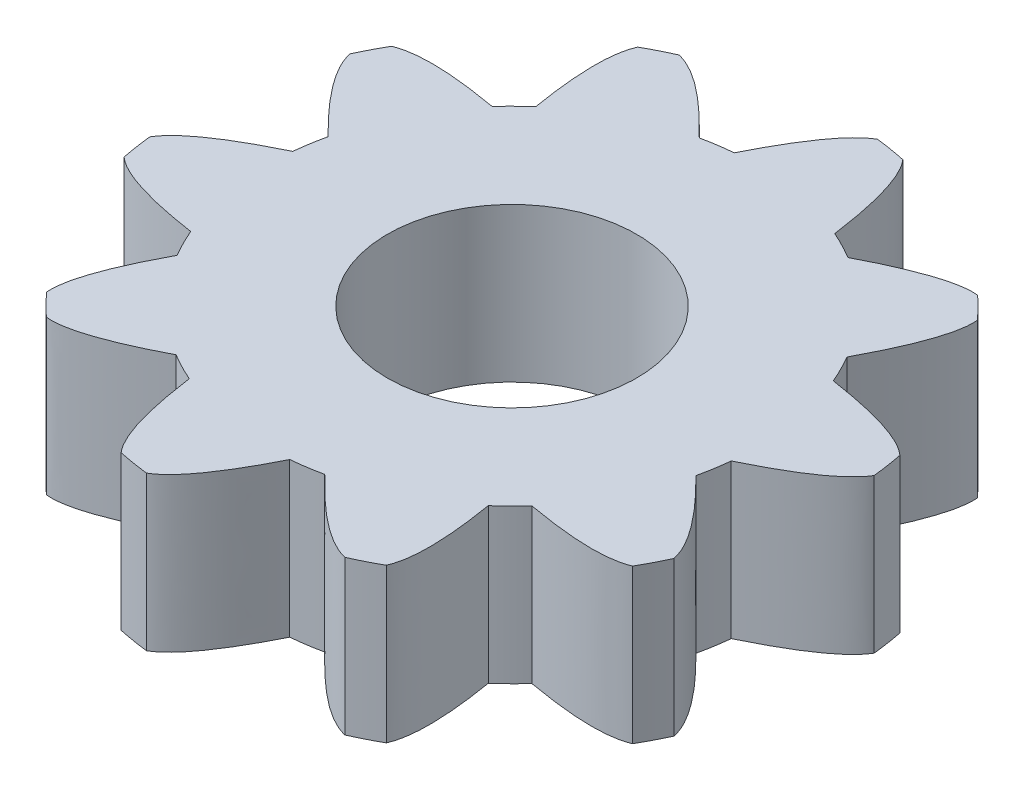
from build123d import *

# Parameters (mm, degrees)
BOSS_EXTRUDE4_DEPTH = 5
CIRPATTERN6_COUNT   = 10
SKETCH2_R           = 4.05
CUT_EXTRUDE1_DEPTH  = 10


with BuildPart() as part:
    # Sketch1 → Boss-Extrude4 (new body)
    with BuildSketch(Plane(origin=(0, 0, 0), x_dir=(1, 0, 0), z_dir=(0, 1, 0))):
        with BuildLine():
            ThreePointArc((7.958110252, 7.164089255), (7.614900879, 7.527880064), (7.255078601, 7.875247815))
            add(Edge.make_bspline(
                [(7.255078601, 7.875247815), (6.306550312, 7.97741942), (4.090117658, 6.826175893)],
                knots=[0.62632571, 0.62632571, 0.62632571, 1, 1, 1], degree=2))
            ThreePointArc((4.090117658, 6.826175893), (-5.659220003, -5.594548126), (6.872732742, 4.011394325))
            add(Edge.make_bspline(
                [(6.872732742, 4.011394325), (8.04937368, 6.214449356), (7.958110252, 7.164089255)],
                knots=[0, 0, 0, 0.37367429, 0.37367429, 0.37367429], degree=2))
        make_face()
    boss_extrude4 = extrude(amount=BOSS_EXTRUDE4_DEPTH)

    # CirPattern6: Boss-Extrude4 ×10 about axis
    cirpattern6_axis = Axis((0, 5, 0), (0, 1, 0))
    for i in range(1, CIRPATTERN6_COUNT):
        add(boss_extrude4.rotate(cirpattern6_axis, i * 360 / CIRPATTERN6_COUNT))

    # Sketch2 → Cut-Extrude1 (cut)
    with BuildSketch(Plane(origin=(0, 5, 0), x_dir=(1, 0, 0), z_dir=(0, 1, 0))):
        Circle(SKETCH2_R)
    extrude(amount=-CUT_EXTRUDE1_DEPTH, mode=Mode.SUBTRACT)


solid = part.part
